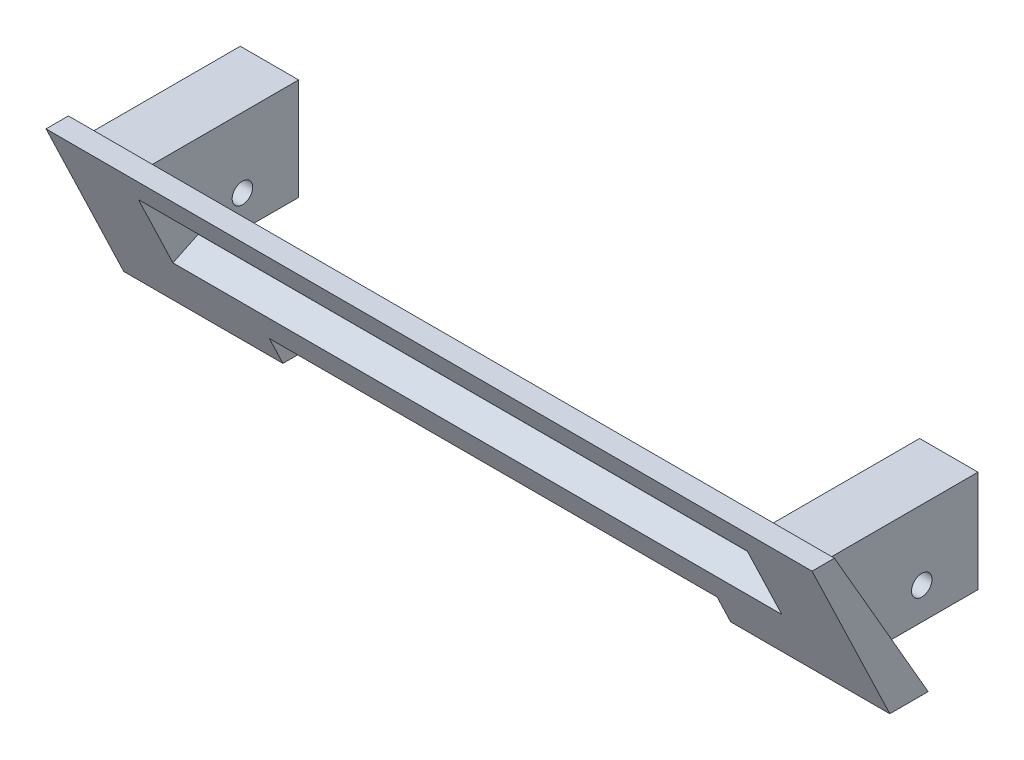
from build123d import *

# Parameters (mm, degrees)
BOSS_EXTRUDE2_DEPTH             = 119.775
BOSS_EXTRUDE1_REACH             = 137.08
SKETCH2_W                       = 18.25
SKETCH2_H                       = 31.825
BOSS_EXTRUDE1_DIRECTION_2_DEPTH = 20
CUT_EXTRUDE4_REACH              = 137.312
SKETCH12_W                      = 140
SKETCH12_H                      = 15
SKETCH12_W_2                    = 190.4
SKETCH12_H_2                    = 25
M6_CLEARANCE_HOLE1_D            = 6.4


with BuildPart() as part:
    # Sketch1 → Boss-Extrude2 (new, symmetric)
    with BuildSketch(Plane(origin=(0, 0, 0), x_dir=(0, 0, -1), z_dir=(1, 0, 0))):
        Polygon((0, 0), (-29.329393675, 50.8), (-36.329393675, 50.8), (-12, 0), align=None)
    extrude(amount=BOSS_EXTRUDE2_DEPTH, both=True)

    # Boss-Extrude1: up to this plane
    boss_extrude1_end = Plane(origin=(119.775, 0, 0), z_dir=(0, -0.5000000000000043, 0.8660254037844362))
    # Sketch2 → Boss-Extrude1 (add, up to the surface)
    with BuildSketch(Plane.XY, mode=Mode.PRIVATE) as boss_extrude1_sk1:
        with Locations((106.225, 31.3125)):
            Rectangle(SKETCH2_W, SKETCH2_H)
    boss_extrude1_tool1 = split(extrude(boss_extrude1_sk1.sketch, amount=BOSS_EXTRUDE1_REACH, mode=Mode.PRIVATE), bisect_by=boss_extrude1_end, keep=Keep.BOTH, mode=Mode.PRIVATE)
    add(boss_extrude1_tool1.solids().sort_by_distance((106.225, 31.3125, 0))[0])
    # Sketch2 → Boss-Extrude1 (add, up to the surface)
    with BuildSketch(Plane.XY, mode=Mode.PRIVATE) as boss_extrude1_sk2:
        with Locations((-106.225, 31.3125)):
            Rectangle(SKETCH2_W, SKETCH2_H)
    boss_extrude1_tool2 = split(extrude(boss_extrude1_sk2.sketch, amount=BOSS_EXTRUDE1_REACH, mode=Mode.PRIVATE), bisect_by=boss_extrude1_end, keep=Keep.BOTH, mode=Mode.PRIVATE)
    add(boss_extrude1_tool2.solids().sort_by_distance((-106.225, 31.3125, 0))[0])

    # Sketch2 → Boss-Extrude1 direction 2 (add)
    with BuildSketch(Plane.XY):
        with Locations((106.225, 31.3125)):
            Rectangle(SKETCH2_W, SKETCH2_H)
        with Locations((-106.225, 31.3125)):
            Rectangle(SKETCH2_W, SKETCH2_H)
    extrude(amount=-BOSS_EXTRUDE1_DIRECTION_2_DEPTH)

    # Sketch12 → Cut-Extrude4 (cut, up to next)
    with BuildSketch(Plane(origin=(0, -4.674837105, 9.761103301), x_dir=(1, 0, 0), z_dir=(0, -0.43194296484667893, 0.901900923117091)), mode=Mode.PRIVATE) as cut_extrude4_sk1:
        with Locations((0, 7.5)):
            Rectangle(SKETCH12_W, SKETCH12_H)
    cut_extrude4_tool1 = extrude(cut_extrude4_sk1.sketch, amount=-CUT_EXTRUDE4_REACH, mode=Mode.PRIVATE) & part.part
    # Sketch12 → Cut-Extrude4 (cut, up to next)
    with BuildSketch(Plane(origin=(0, -4.674837105, 9.761103301), x_dir=(1, 0, 0), z_dir=(0, -0.43194296484667893, 0.901900923117091)), mode=Mode.PRIVATE) as cut_extrude4_sk2:
        with Locations((0, 39.008792909)):
            Rectangle(SKETCH12_W_2, SKETCH12_H_2)
    cut_extrude4_tool2 = extrude(cut_extrude4_sk2.sketch, amount=-CUT_EXTRUDE4_REACH, mode=Mode.PRIVATE) & part.part
    add(cut_extrude4_tool1.solids().sort_by_distance((0, 2.08942, 13.000676))[0], mode=Mode.SUBTRACT)
    add(cut_extrude4_tool2.solids().sort_by_distance((0, 30.507229, 26.610677))[0], mode=Mode.SUBTRACT)

    # M6 Clearance Hole1 (through all)
    with Locations(Plane(origin=(115.35, 0, 0), x_dir=(0, 0, -1), z_dir=(1, 0, 0))):
        with Locations((2.420606325, 25.4)):
            Hole(M6_CLEARANCE_HOLE1_D / 2)


solid = part.part
